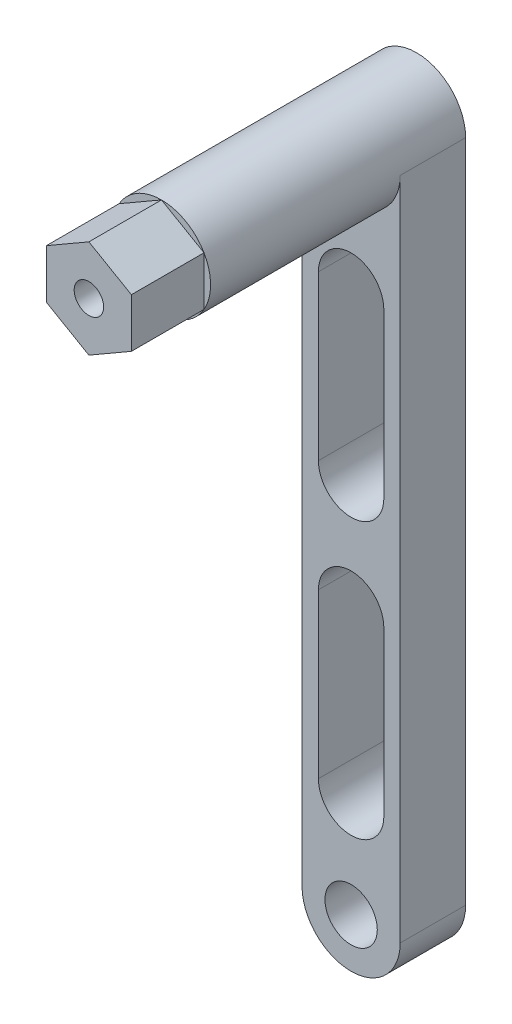
from build123d import *

# Parameters (mm, degrees)
SKETCH1_R           = 4
BOSS_EXTRUDE1_DEPTH = 10
BOSS_EXTRUDE2_DEPTH = 38.98
BOSS_EXTRUDE3_DEPTH = 11.1
SKETCH4_R           = 2.25
CUT_EXTRUDE1_DEPTH  = 10


with BuildPart() as part:
    # Sketch1 → Boss-Extrude1 (new body)
    with BuildSketch(Plane.XY):
        with BuildLine():
            Line((-7.5, 50.8), (-7.5, -50.8))
            ThreePointArc((-7.5, -50.8), (0, -58.3), (7.5, -50.8))
            Line((7.5, -50.8), (7.5, 50.8))
            ThreePointArc((7.5, 50.8), (0, 43.3), (-7.5, 50.8))
        make_face()
        with Locations((0, -50.8)):
            Circle(SKETCH1_R, mode=Mode.SUBTRACT)
        with BuildLine():
            ThreePointArc((5, -35.3), (0, -40.3), (-5, -35.3))
            Line((-5, -35.3), (-5, -10.3))
            ThreePointArc((-5, -10.3), (0, -5.3), (5, -10.3))
            Line((5, -10.3), (5, -35.3))
        make_face(mode=Mode.SUBTRACT)
        with BuildLine():
            ThreePointArc((-5, 31.8), (0, 36.8), (5, 31.8))
            Line((5, 31.8), (5, 6.8))
            ThreePointArc((5, 6.8), (0, 1.8), (-5, 6.8))
            Line((-5, 6.8), (-5, 31.8))
        make_face(mode=Mode.SUBTRACT)
    extrude(amount=BOSS_EXTRUDE1_DEPTH)

    # Sketch1<4> → Boss-Extrude2 (add)
    with BuildSketch(Plane.XY):
        with BuildLine():
            ThreePointArc((7.5, 50.8), (0, 58.3), (-7.5, 50.8))
            ThreePointArc((-7.5, 50.8), (0, 43.3), (7.5, 50.8))
        make_face()
    extrude(amount=BOSS_EXTRUDE2_DEPTH)

    # Sketch3 → Boss-Extrude3 (add)
    with BuildSketch(Plane.XY.offset(38.98)):
        Polygon((0, 43.3), (6.495190528, 47.05), (6.495190528, 54.55), (0, 58.3), (-6.495190528, 54.55), (-6.495190528, 47.05), align=None)
    extrude(amount=BOSS_EXTRUDE3_DEPTH)

    # Sketch4 → Cut-Extrude1 (cut)
    with BuildSketch(Plane.XY.offset(50.08)):
        with Locations((0, 50.8)):
            Circle(SKETCH4_R)
    extrude(amount=-CUT_EXTRUDE1_DEPTH, mode=Mode.SUBTRACT)


solid = part.part
